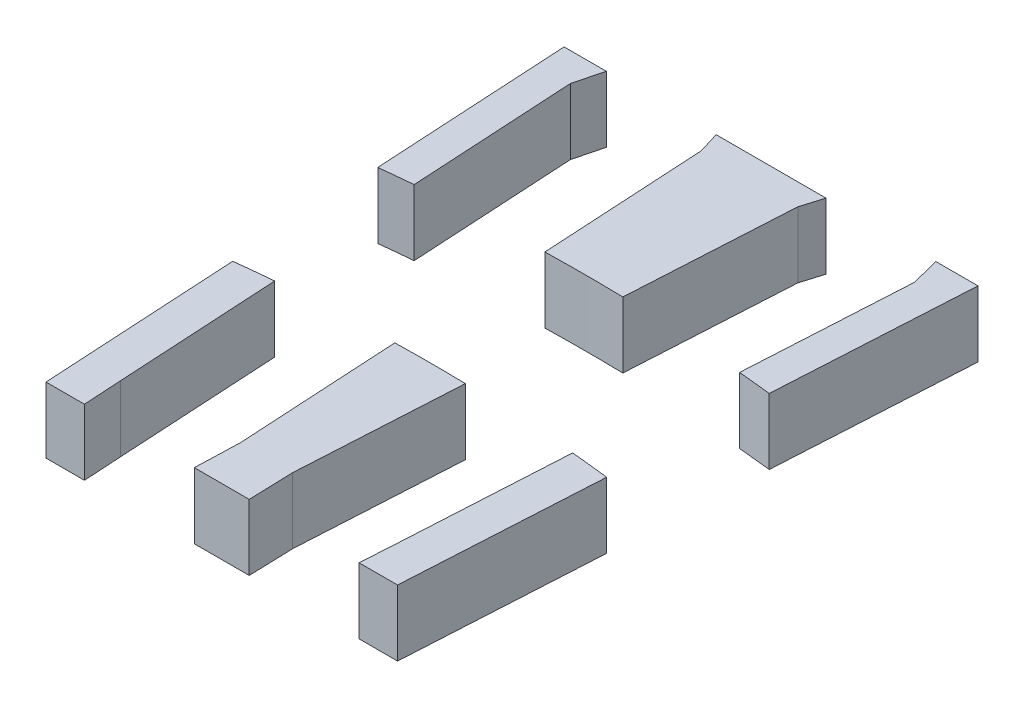
from build123d import *

# Parameters (mm, degrees)
BOSS_EXTRUDE1_DEPTH      = 3
CUT_EXTRUDE1_DEPTH       = 91.044316414
BOSS_EXTRUDE2_DEPTH      = 3
CUT_EXTRUDE7_DEPTH       = 91.044316414
CUT_EXTRUDE9_DEPTH       = 91.044316414
MIRROR10_DEPTH           = 3
CUT_EXTRUDE10_DEPTH      = 91.044316414
CUT_EXTRUDE10_DEPTH_BACK = 91.044316414


# Read off the part's stored shape, not the designer's step: Mirror10
with BuildPart() as part:
    # Sketch1 → Boss-Extrude1 (new body)
    with BuildSketch(Plane(origin=(0, 0, 0), x_dir=(1, 0, 0), z_dir=(0, 1, 0))):
        Polygon((-9.419602878, 89.5), (-8, 64.5), (0, 64.5), (0, 89.5), align=None)
    extrude(amount=BOSS_EXTRUDE1_DEPTH)

    # Sketch2 → Cut-Extrude1 (cut, symmetric)
    with BuildSketch(Plane(origin=(0, 3, 0), x_dir=(1, 0, 0), z_dir=(0, 1, 0))):
        Polygon((-6.585534884, 66.233172431), (-0.954605862, 66.552919753), (-2.201847188, 88.517536505), (-7.83277621, 88.197789183), align=None)
    extrude(amount=CUT_EXTRUDE1_DEPTH, both=True, mode=Mode.SUBTRACT)

    # Sketch6 → Boss-Extrude2 (add)
    with BuildSketch(Plane(origin=(0, 3, 0), x_dir=(1, 0, 0), z_dir=(0, 1, 0))):
        Polygon((-6.585534884, 66.233172431), (-6.3559048, 66.246211772), (-6.866139888, 75.231736807), (-7.322541122, 79.212264148), align=None)
    boss_extrude2 = extrude(amount=-BOSS_EXTRUDE2_DEPTH)

    # Mirror3: Boss-Extrude2 across plane
    add(boss_extrude2.mirror(Plane(origin=(0, 0, 0), x_dir=(0.05669278756337804, 0, 0.9983916705573488), z_dir=(0.9983916705573489, 0, -0.05669278756337803))))

    # Sketch7 → Cut-Extrude7 (cut, symmetric)
    with BuildSketch(Plane(origin=(0, 3, 0), x_dir=(1, 0, 0), z_dir=(0, 1, 0))):
        Polygon((-7.5, 89.5), (-7.83277621, 88.197789183), (-2.201847188, 88.517536505), (-2.5, 89.5), align=None)
    extrude(amount=CUT_EXTRUDE7_DEPTH, both=True, mode=Mode.SUBTRACT)

    # Sketch14 → Cut-Extrude9 (cut, symmetric)
    with BuildSketch(Plane(origin=(0, 3, 0), x_dir=(1, 0, 0), z_dir=(0, 1, 0))):
        Polygon((-6.3559048, 66.246211772), (-6.25, 64.5), (-1.25, 64.5), (-1.184235946, 66.539880412), align=None)
    extrude(amount=CUT_EXTRUDE9_DEPTH, both=True, mode=Mode.SUBTRACT)


with BuildPart() as cut_extrude9_piece_1:
    # of the separate pieces the step leaves, piece 1, a body of its own (cut_extrude9_pieces)
    add(part.part.solids().sort_by_distance((-1.25, 0, -64.5))[0])

    # Mirror10 outline → Mirror10 (add)
    with BuildSketch(Plane(origin=(0, 0, 0), x_dir=(1, 0, 0), z_dir=(0, 1, 0))):
        Polygon((0, 64.5), (1.25, 64.5), (1.184235946, 66.539880412), (1.694471034, 75.525405447), (1.6916121, 79.53201147), (2.201847188, 88.517536505), (2.5, 89.5), (0, 89.5), align=None)
    extrude(amount=MIRROR10_DEPTH)


with BuildPart() as cut_extrude9_piece_2:
    # of the separate pieces the step leaves, piece 2, a body of its own (cut_extrude9_pieces)
    add(part.part.solids().sort_by_distance((-9.419602878, 0, -89.5))[0])


with BuildPart() as body_3:
    # Mirror12: mirrored copy
    add(cut_extrude9_piece_2.part.mirror(Plane(origin=(0, 0, 0), x_dir=(0, 0, 1), z_dir=(1, 0, 0))))


with BuildPart() as cut_extrude10_tool:
    # Sketch15 → Cut-Extrude10 (new, two sides: drawn at the far end of the back side and taken through both)
    with BuildSketch(Plane(origin=(0, 3, 0), x_dir=(1, 0, 0), z_dir=(0, 1, 0)).offset(-CUT_EXTRUDE10_DEPTH_BACK)):
        with BuildLine():
            Line((-8.511560468, 73.508865713), (-8.909032235, 80.50856566))
            ThreePointArc((-8.909032235, 80.50856566), (0, 81), (8.909032235, 80.50856566))
            Line((8.909032235, 80.50856566), (8.511560468, 73.508865713))
            ThreePointArc((8.511560468, 73.508865713), (0, 74), (-8.511560468, 73.508865713))
        make_face()
    extrude(amount=CUT_EXTRUDE10_DEPTH + CUT_EXTRUDE10_DEPTH_BACK)


with BuildPart() as cut_extrude9_piece_1_1:
    add(cut_extrude9_piece_1.part)

    # Cut-Extrude10: cut by cut_extrude10_tool
    add(cut_extrude10_tool.part, mode=Mode.SUBTRACT)


with BuildPart() as cut_extrude9_piece_2_1:
    add(cut_extrude9_piece_2.part)

    # Cut-Extrude10: cut by cut_extrude10_tool
    add(cut_extrude10_tool.part, mode=Mode.SUBTRACT)


with BuildPart() as body_3_1:
    add(body_3.part)

    # Cut-Extrude10: cut by cut_extrude10_tool
    add(cut_extrude10_tool.part, mode=Mode.SUBTRACT)


with BuildPart() as cut_extrude10_piece_1:
    # of the separate pieces the step leaves, piece 1, a body of its own (cut_extrude10_pieces)
    add(cut_extrude9_piece_1_1.part.solids().sort_by_distance((-1.773867452, 0, -80.980574178))[0])


with BuildPart() as cut_extrude10_piece_2:
    # of the separate pieces the step leaves, piece 2, a body of its own (cut_extrude10_pieces)
    add(cut_extrude9_piece_1_1.part.solids().sort_by_distance((-1.25, 0, -64.5))[0])


with BuildPart() as cut_extrude10_piece_1_of_cut_extrude9_pi:
    # of the separate pieces the step leaves, piece 1, a body of its own (cut_extrude10_pieces_of_cut_extrude9_pie)
    add(cut_extrude9_piece_2_1.part.solids().sort_by_distance((-8.511560468, 0, -73.508865713))[0])


with BuildPart() as cut_extrude10_piece_2_of_cut_extrude9_pi:
    # of the separate pieces the step leaves, piece 2, a body of its own (cut_extrude10_pieces_of_cut_extrude9_pie)
    add(cut_extrude9_piece_2_1.part.solids().sort_by_distance((-9.419602878, 0, -89.5))[0])


with BuildPart() as cut_extrude10_piece_1_of_body_3:
    # of the separate pieces the step leaves, piece 1, a body of its own (cut_extrude10_pieces_of_body_3)
    add(body_3_1.part.solids().sort_by_distance((8.511560468, 0, -73.508865713))[0])


with BuildPart() as cut_extrude10_piece_2_of_body_3:
    # of the separate pieces the step leaves, piece 2, a body of its own (cut_extrude10_pieces_of_body_3)
    add(body_3_1.part.solids().sort_by_distance((9.419602878, 0, -89.5))[0])


solid = Compound([cut_extrude10_piece_1.part, cut_extrude10_piece_2.part, cut_extrude10_piece_1_of_cut_extrude9_pi.part, cut_extrude10_piece_2_of_cut_extrude9_pi.part, cut_extrude10_piece_1_of_body_3.part, cut_extrude10_piece_2_of_body_3.part])
